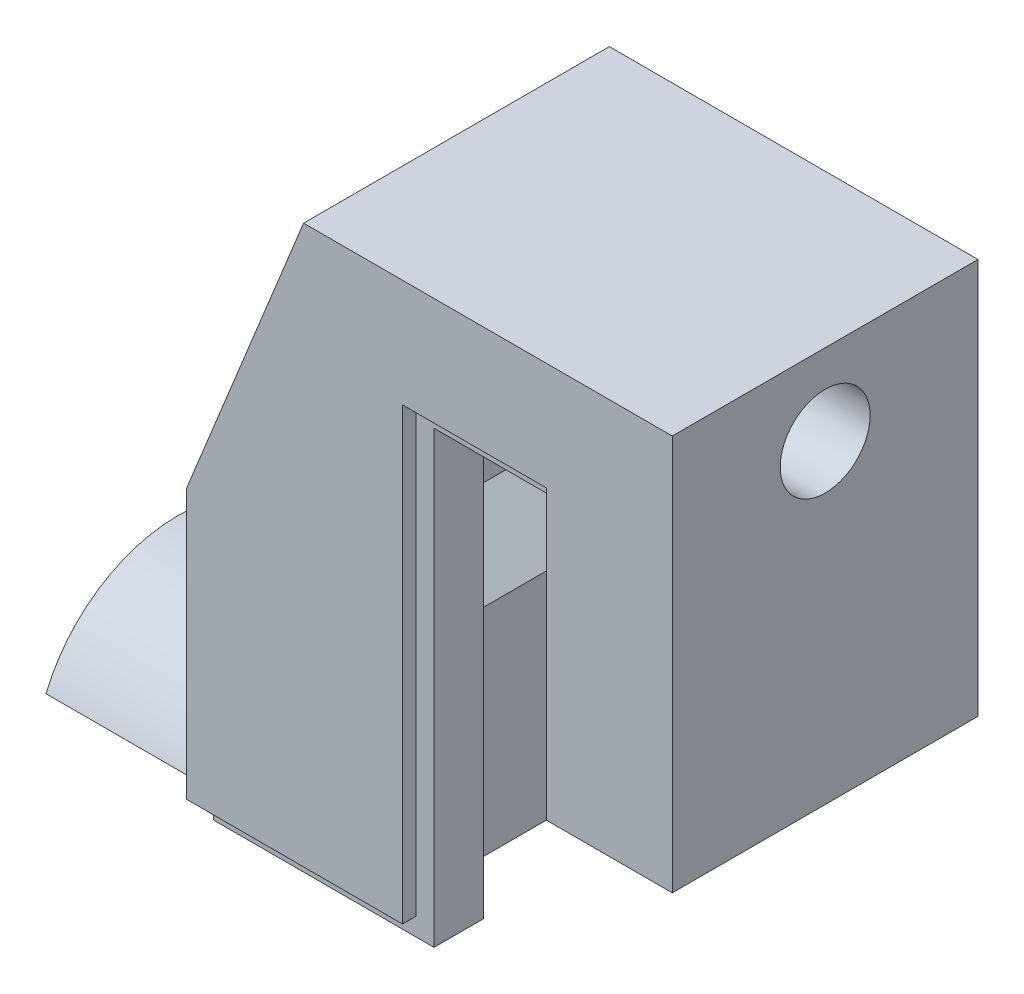
from build123d import *

# Parameters (mm, degrees)
SKETCH1_W           = 13
SKETCH1_H           = 17
BOSS_EXTRUDE1_DEPTH = 30
SKETCH2_R           = 5.75
CUT_EXTRUDE1_DEPTH  = 5
SKETCH3_W           = 3
SKETCH3_H           = 10
CUT_EXTRUDE2_DEPTH  = 32.851216617
SKETCH4_W           = 27
SKETCH4_H           = 17
BOSS_EXTRUDE2_DEPTH = 2
SKETCH5_W           = 7
SKETCH5_H           = 17
BOSS_EXTRUDE3_DEPTH = 20
SKETCH6_W           = 7
SKETCH6_H           = 3.5
BOSS_EXTRUDE4_DEPTH = 5
SKETCH7_R           = 2.5
CUT_EXTRUDE3_DEPTH  = 7
CUT_EXTRUDE4_DEPTH  = 42.632319176
CUT_EXTRUDE5_DEPTH  = 1
SKETCH11_W          = 0.75
SKETCH11_H          = 24
CUT_EXTRUDE6_DEPTH  = 1
SKETCH12_W          = 8
SKETCH12_H          = 0.75
CUT_EXTRUDE7_DEPTH  = 1
CUT_EXTRUDE8_DEPTH  = 13
SKETCH14_W          = 10
SKETCH14_H          = 15
CUT_EXTRUDE9_DEPTH  = 3
CHAMFER1_SIZE       = 3
BOSS_EXTRUDE5_DEPTH = 8
BOSS_EXTRUDE6_DEPTH = 1


with BuildPart() as part:
    # Sketch1 → Boss-Extrude1 (new body)
    with BuildSketch(Plane(origin=(0, 0, 0), x_dir=(1, 0, 0), z_dir=(0, 1, 0))):
        Rectangle(SKETCH1_W, SKETCH1_H)
    extrude(amount=BOSS_EXTRUDE1_DEPTH)

    # Sketch2 → Cut-Extrude1 (cut)
    with BuildSketch(Plane.ZY.offset(6.5)):
        with Locations((0, -2)):
            Circle(SKETCH2_R)
    extrude(amount=-CUT_EXTRUDE1_DEPTH, mode=Mode.SUBTRACT)

    # Sketch3 → Cut-Extrude2 (cut, through all)
    with BuildSketch(Plane.XZ):
        with Locations((5, 0)):
            Rectangle(SKETCH3_W, SKETCH3_H)
    extrude(amount=-CUT_EXTRUDE2_DEPTH, mode=Mode.SUBTRACT)

    # Sketch4 → Boss-Extrude2 (add)
    with BuildSketch(Plane(origin=(0, 30, 0), x_dir=(1, 0, 0), z_dir=(0, 1, 0))):
        with Locations((7, 0)):
            Rectangle(SKETCH4_W, SKETCH4_H)
    extrude(amount=BOSS_EXTRUDE2_DEPTH)

    # Sketch5 → Boss-Extrude3 (add)
    with BuildSketch(Plane.XZ.offset(-30)):
        with Locations((17, 0)):
            Rectangle(SKETCH5_W, SKETCH5_H)
    extrude(amount=BOSS_EXTRUDE3_DEPTH)

    # Sketch6 → Boss-Extrude4 (add)
    with BuildSketch(Plane.XZ.offset(-30)):
        with Locations((10, 6.75)):
            Rectangle(SKETCH6_W, SKETCH6_H)
        with Locations((10, -6.75)):
            Rectangle(SKETCH6_W, SKETCH6_H)
    extrude(amount=BOSS_EXTRUDE4_DEPTH)

    # Sketch7 → Cut-Extrude3 (cut)
    with BuildSketch(Plane(origin=(20.5, 0, 0), x_dir=(0, 0, -1), z_dir=(1, 0, 0))):
        with Locations((0, 27.5)):
            Circle(SKETCH7_R)
    extrude(amount=-CUT_EXTRUDE3_DEPTH, mode=Mode.SUBTRACT)

    # Sketch9 → Cut-Extrude4 (cut, through all)
    with BuildSketch(Plane.XY.offset(8.5)):
        Polygon((0, 32), (-6.5, 16), (-6.5, 32), align=None)
    extrude(amount=-CUT_EXTRUDE4_DEPTH, mode=Mode.SUBTRACT)

    # Sketch10 → Cut-Extrude5 (cut)
    with BuildSketch(Plane.XZ):
        Polygon((-5.75, 5.390964663), (-5.75, 7.75), (6.5, 7.75), (6.5, 8.5), (-6.5, 8.5), (-6.5, 5.390964663), align=None)
        Polygon((-5.75, -7.75), (-5.75, -5.390964663), (-6.5, -5.390964663), (-6.5, -8.5), (6.5, -8.5), (6.5, -7.75), align=None)
    extrude(amount=-CUT_EXTRUDE5_DEPTH, mode=Mode.SUBTRACT)

    # Sketch11 → Cut-Extrude6 (cut)
    with BuildSketch(Plane(origin=(6.5, 0, 0), x_dir=(0, 0, -1), z_dir=(1, 0, 0))):
        with Locations((-8.125, 13)):
            Rectangle(SKETCH11_W, SKETCH11_H)
        with Locations((8.125, 13)):
            Rectangle(SKETCH11_W, SKETCH11_H)
    extrude(amount=-CUT_EXTRUDE6_DEPTH, mode=Mode.SUBTRACT)

    # Sketch12 → Cut-Extrude7 (cut)
    with BuildSketch(Plane.XZ.offset(-25)):
        with Locations((9.5, -8.125)):
            Rectangle(SKETCH12_W, SKETCH12_H)
        with Locations((9.5, 8.125)):
            Rectangle(SKETCH12_W, SKETCH12_H)
    extrude(amount=-CUT_EXTRUDE7_DEPTH, mode=Mode.SUBTRACT)

    # Sketch13 → Cut-Extrude8 (cut)
    with BuildSketch(Plane.XZ.offset(-10)):
        with BuildLine():
            Line((13.5, -8.5), (13.5, 8.5))
            add(Edge.make_bspline(
                [(13.5, -8.5), (15.857076701, -7.146482538), (17.987215619, 0.415145569), (16.168492061, 6.316191401), (13.5, 8.5)],
                knots=[0, 0, 0, 0, 0.5, 1, 1, 1, 1], degree=3))
        make_face()
    extrude(amount=-CUT_EXTRUDE8_DEPTH, mode=Mode.SUBTRACT)

    # Sketch14 → Cut-Extrude9 (cut)
    with BuildSketch(Plane(origin=(3.5, 0, 0), x_dir=(0, 0, -1), z_dir=(1, 0, 0))):
        with Locations((0, 22.5)):
            Rectangle(SKETCH14_W, SKETCH14_H)
    extrude(amount=-CUT_EXTRUDE9_DEPTH, mode=Mode.SUBTRACT)

    # Chamfer1
    chamfer1_edges = [part.edges().sort_by_distance(p)[0] for p in [
        (3.5, 15, 0),
    ]]
    chamfer(chamfer1_edges, length=CHAMFER1_SIZE - 0.0001)  # a hair under: the kernel refuses the full size

    # Sketch15 → Boss-Extrude5 (add)
    with BuildSketch(Plane.ZY.offset(6.5)):
        with BuildLine():
            Line((-7.322463691, 1), (-6.32455532, 1))
            ThreePointArc((-6.32455532, 1), (0, 5), (6.32455532, 1))
            Line((6.32455532, 1), (7.322463691, 1))
            ThreePointArc((7.322463691, 1), (0, 5.913183588), (-7.322463691, 1))
        make_face()
    extrude(amount=BOSS_EXTRUDE5_DEPTH)

    # Sketch16 → Boss-Extrude6 (add)
    with BuildSketch(Plane.ZY.offset(14.5)):
        with BuildLine():
            Line((-7.322463691, 1), (7.322463691, 1))
            ThreePointArc((7.322463691, 1), (0, 5.913183588), (-7.322463691, 1))
        make_face()
    extrude(amount=BOSS_EXTRUDE6_DEPTH)


solid = part.part
